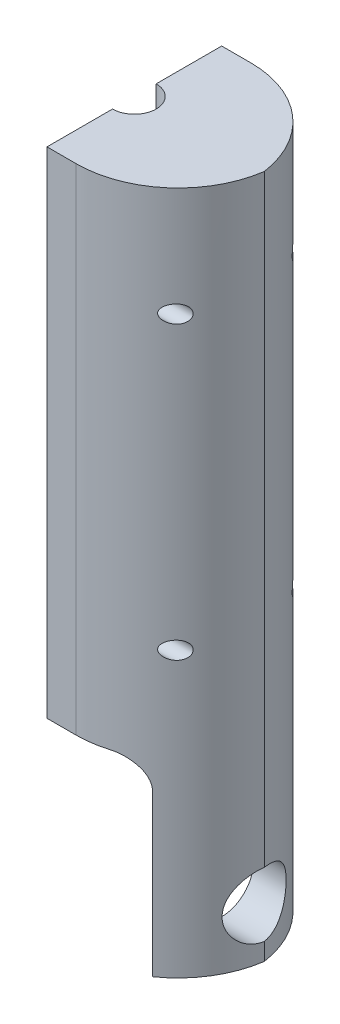
from build123d import *

# Parameters (mm, degrees)
BOSS_EXTRU_1_DEPTH            = 60
CONG_4_R                      = 35
CONG_5_R                      = 35
CONG_6_R                      = 35
CONG_12_R                     = 10
ESQUISSE3_R                   = 11
ENL_V_MAT_EXTRU_4_DEPTH       = 50
ENL_V_MAT_EXTRU_8_DEPTH       = 251
ESQUISSE6_R                   = 2
ENL_V_MAT_EXTRU_9_DEPTH       = 58
ENL_V_MAT_EXTRU_12_DEPTH      = 256.753178134
ENL_V_MAT_EXTRU_12_DEPTH_BACK = 179
COQUE1_T                      = -5
ENL_V_START                   = 20
ESQUISSE11_R                  = 3
ESQUISSE11_R_2                = 2
ENL_V_MAT_EXTRU_14_DEPTH      = 20
BOSS_EXTRU_2_DEPTH            = 5


with BuildPart() as part:
    # Esquisse1 → Boss.-Extru.1 (new body)
    with BuildSketch(Plane.XY):
        Polygon((-139.391143911, 131.10701107), (-139.391143911, -98.89298893), (-124.391143911, -98.89298893), (-124.391143911, -33.89298893), (-64.391143911, -33.89298893), (-64.391143911, -98.89298893), (-49.391143911, -98.89298893), (-49.391143911, 131.10701107), align=None)
    extrude(amount=BOSS_EXTRU_1_DEPTH)

    # Congé4
    cong_4_edges = [part.edges().sort_by_distance(p)[0] for p in [
        (-139.391143911, 16.10701107, 60),
    ]]
    fillet(cong_4_edges, radius=CONG_4_R)

    # Congé5
    # the kernel refuses this fillet: 35 mm, written as the material it takes off along each edge
    with BuildSketch(Plane(origin=(-139.391143911, 214.959560226, 0), x_dir=(0, 0, 1), z_dir=(0, -1, 0))) as cong_5_piece_1:
        with BuildLine():
            CenterArc((35, -33.541019662), CONG_5_R, 106.601549599, 73.398450401)
            Line((0, -33.541019662), (-0.7, -33.541019662))
            Line((-0.7, -33.541019662), (-0.7, 0))
            Line((-0.7, 0), (0, 0.7))
            ThreePointArc((0, 0.7), (12.5, 0.7), (24.8, 0.670820393))
            Line((24.8, 0.670820393), (25, 0))
        make_face()
    extrude(amount=397.705098312, mode=Mode.SUBTRACT)

    # Congé6
    # the kernel refuses this fillet: 35 mm, written as the material it takes off along each edge
    with BuildSketch(Plane(origin=(-49.391143911, -186.39298893, 0), x_dir=(-1, 0, 0), z_dir=(0, 1, 0))) as cong_6_piece_1:
        with BuildLine():
            CenterArc((CONG_6_R, CONG_6_R), CONG_6_R, 180, 90)
            Line((0, CONG_6_R), (0, 0))
            Line((0, 0), (CONG_6_R, 0))
        make_face()
    extrude(amount=405, mode=Mode.SUBTRACT)
    with BuildSketch(Plane(origin=(-49.391143911, -186.39298893, 60), x_dir=(-1, 0, 0), z_dir=(0, 1, 0))) as cong_6_piece_2:
        with BuildLine():
            CenterArc((CONG_6_R, -CONG_6_R), CONG_6_R, 90, 90)
            Line((0, -CONG_6_R), (0, 0))
            Line((0, 0), (CONG_6_R, 0))
        make_face()
    extrude(amount=405, mode=Mode.SUBTRACT)

    # Congé12
    cong_12_edges = [part.edges().sort_by_distance(p)[0] for p in [
        (-124.391143911, -33.89298893, 29.518642471),
        (-64.391143911, -33.89298893, 30),
    ]]
    fillet(cong_12_edges, radius=CONG_12_R)

    # Esquisse3 → Enlèv. mat.-Extru.4 (cut)
    with BuildSketch(Plane.ZY.offset(64.391143911)):
        with Locations(Location((30, -81.917553746, 0), (0, 0, 270))):
            Circle(ESQUISSE3_R)
    extrude(amount=-ENL_V_MAT_EXTRU_4_DEPTH, mode=Mode.SUBTRACT)

    # Esquisse5 → Enlèv. mat.-Extru.8 (cut)
    with BuildSketch(Plane(origin=(0, 131.10701107, 0), x_dir=(1, 0, 0), z_dir=(0, 1, 0))):
        with BuildLine():
            Line((-94.391143911, -60), (-94.391143911, 0))
            ThreePointArc((-94.391143911, 0), (-165.244647607, -30), (-94.391143911, -60))
        make_face()
    extrude(amount=-ENL_V_MAT_EXTRU_8_DEPTH, mode=Mode.SUBTRACT)

    # Esquisse6 → Enlèv. mat.-Extru.9 (cut)
    with BuildSketch(Plane.ZY.offset(94.391143911)):
        with Locations((10, 98.60701107)):
            Circle(ESQUISSE6_R)
        with Locations((50, 98.60701107)):
            Circle(ESQUISSE6_R)
        with Locations((50, -1.39298893)):
            Circle(ESQUISSE6_R)
        with Locations((10, -1.39298893)):
            Circle(ESQUISSE6_R)
    extrude(amount=-ENL_V_MAT_EXTRU_9_DEPTH, mode=Mode.SUBTRACT)

    # Esquisse9 → Enlèv. mat.-Extru.12 (cut, two sides: drawn at the far end of the back side and taken through both)
    with BuildSketch(Plane(origin=(0, 131.10701107, 0), x_dir=(1, 0, 0), z_dir=(0, 1, 0)).offset(-ENL_V_MAT_EXTRU_12_DEPTH_BACK)):
        with BuildLine():
            Line((-220.994237172, -22.5), (-94.391143911, -22.5))
            ThreePointArc((-94.391143911, -22.5), (-86.891143911, -30), (-94.391143911, -37.5))
            Line((-94.391143911, -37.5), (-220.994237172, -37.5))
            Line((-220.994237172, -37.5), (-474.200423692, -37.5))
            Line((-474.200423692, -37.5), (-474.200423692, -22.5))
            Line((-474.200423692, -22.5), (-220.994237172, -22.5))
        make_face()
    extrude(amount=ENL_V_MAT_EXTRU_12_DEPTH + ENL_V_MAT_EXTRU_12_DEPTH_BACK, mode=Mode.SUBTRACT)

    # Coque1
    coque1_openings = [part.faces().sort_by_distance(p)[0] for p in [
        (-74.759269285, 131.10701107, 30),
    ]]
    offset(amount=COQUE1_T, openings=coque1_openings)

    # Esquisse11 → Enlèv. mat.-Extru.14 (cut)
    # profile 1 of 4: a face of its own
    with BuildSketch(Plane.ZY.offset(49.75012776).offset(ENL_V_START)):
        with Locations(Location((50, 98.60701107, 0), (0, 0, 180))):
            Circle(ESQUISSE11_R)
        with Locations((50, 98.60701107)):
            Circle(ESQUISSE11_R_2, mode=Mode.SUBTRACT)
    # profile 2 of 4: a face of its own
    with BuildSketch(Plane.ZY.offset(49.75012776).offset(ENL_V_START)):
        with Locations(Location((10, 98.60701107, 0), (0, 0, 180))):
            Circle(ESQUISSE11_R)
        with Locations((10, 98.60701107)):
            Circle(ESQUISSE11_R_2, mode=Mode.SUBTRACT)
    # profile 3 of 4: a face of its own
    with BuildSketch(Plane.ZY.offset(49.75012776).offset(ENL_V_START)):
        with Locations(Location((50, -1.39298893, 0), (0, 0, 180))):
            Circle(ESQUISSE11_R)
        with Locations((50, -1.39298893)):
            Circle(ESQUISSE11_R_2, mode=Mode.SUBTRACT)
    # profile 4 of 4: a face of its own
    with BuildSketch(Plane.ZY.offset(49.75012776).offset(ENL_V_START)):
        with Locations(Location((10, -1.39298893, 0), (0, 0, 180))):
            Circle(ESQUISSE11_R)
        with Locations((10, -1.39298893)):
            Circle(ESQUISSE11_R_2, mode=Mode.SUBTRACT)
    extrude(amount=-ENL_V_MAT_EXTRU_14_DEPTH, mode=Mode.SUBTRACT)

    # Esquisse12 → Boss.-Extru.2 (add)
    with BuildSketch(Plane(origin=(0, 131.10701107, 0), x_dir=(1, 0, 0), z_dir=(0, 1, 0))):
        with BuildLine():
            Line((-84.391143911, 0), (-94.391143911, 0))
            Line((-94.391143911, 0), (-94.391143911, -22.5))
            ThreePointArc((-94.391143911, -22.5), (-86.891143911, -30), (-94.391143911, -37.5))
            Line((-94.391143911, -37.5), (-94.391143911, -60))
            Line((-94.391143911, -60), (-84.391143911, -60))
            ThreePointArc((-84.391143911, -60), (-61.478265437, -51.457513111), (-49.75012776, -30))
            ThreePointArc((-49.75012776, -30), (-61.478265437, -8.542486889), (-84.391143911, 0))
        make_face()
    extrude(amount=BOSS_EXTRU_2_DEPTH)


solid = part.part
